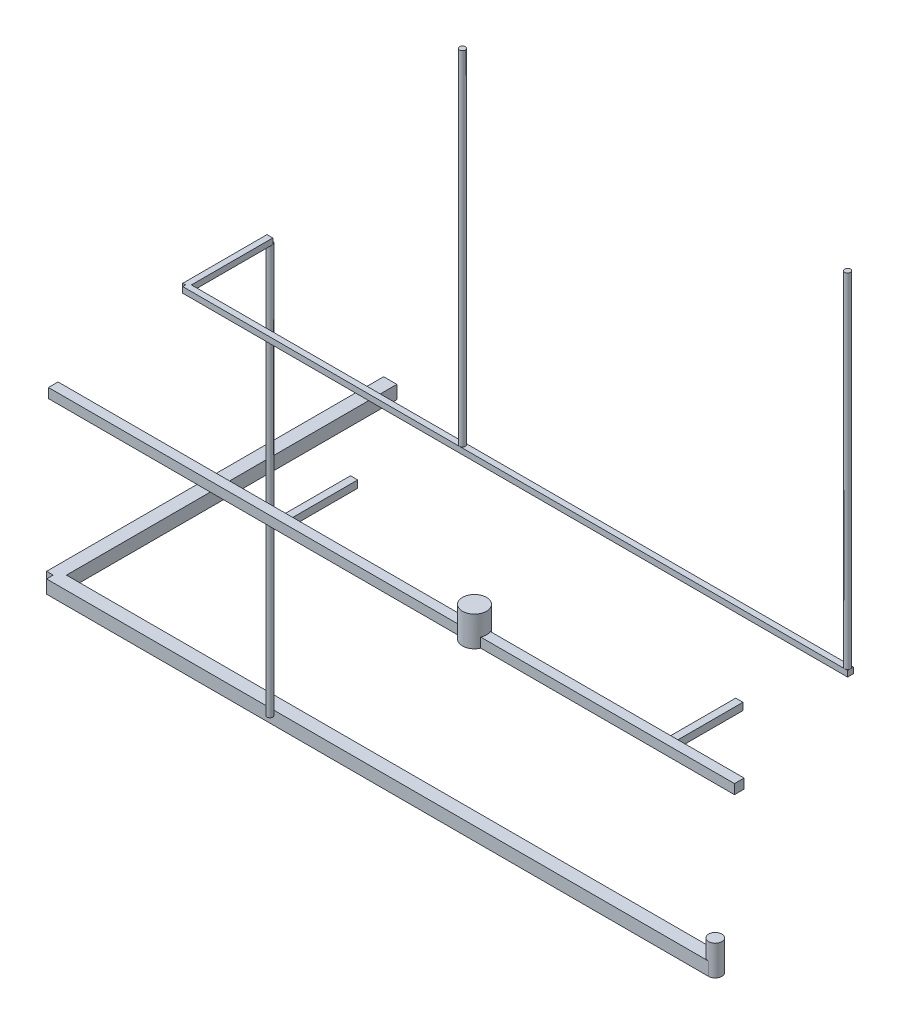
from build123d import *

# Parameters (mm, degrees)
BOSS_EXTRUDE1_START  = 400
SKETCH1_R            = 24
BOSS_EXTRUDE1_DEPTH  = 3400
BOSS_EXTRUDE2_START  = 3800
SKETCH2_W            = 48
SKETCH2_H            = 700
BOSS_EXTRUDE2_DEPTH  = 48
BOSS_EXTRUDE3_START  = 3800
SKETCH3_W            = 5524
SKETCH3_H            = 48
BOSS_EXTRUDE3_DEPTH  = 48
BOSS_EXTRUDE4_START  = 3800
SKETCH4_R            = 24
BOSS_EXTRUDE4_DEPTH  = 2900
BOSS_EXTRUDE5_START  = 3800
SKETCH5_R            = 24
BOSS_EXTRUDE5_DEPTH  = 2900
BOSS_EXTRUDE6_START  = 3600
SKETCH6_W            = 5700
SKETCH6_H            = 80
BOSS_EXTRUDE6_DEPTH  = 80
BOSS_EXTRUDE7_START  = 3600
SKETCH7_R            = 100
BOSS_EXTRUDE7_DEPTH  = 250
BOSS_EXTRUDE8_START  = 3600
SKETCH8_W            = 60
SKETCH8_H            = 600
BOSS_EXTRUDE8_DEPTH  = 60
BOSS_EXTRUDE9_START  = 3600
SKETCH9_W            = 60
SKETCH9_H            = 600
BOSS_EXTRUDE9_DEPTH  = 60
BOSS_EXTRUDE10_START = 200
SKETCH10_R           = 55
BOSS_EXTRUDE10_DEPTH = 250
BOSS_EXTRUDE11_START = 200
SKETCH11_W           = 5500
SKETCH11_H           = 110
BOSS_EXTRUDE11_DEPTH = 110
BOSS_EXTRUDE12_START = 200
SKETCH12_W           = 110
SKETCH12_H           = 2800
BOSS_EXTRUDE12_DEPTH = 110


with BuildPart() as part:
    # Sketch1 → Boss-Extrude1 (new body)
    with BuildSketch(Plane(origin=(0, 0, 0), x_dir=(1, 0, 0), z_dir=(0, 1, 0)).offset(BOSS_EXTRUDE1_START)):
        with Locations((-3500, 1000)):
            Circle(SKETCH1_R)
    extrude(amount=BOSS_EXTRUDE1_DEPTH)

    # Sketch2 → Boss-Extrude2 (add)
    with BuildSketch(Plane(origin=(0, 0, 0), x_dir=(1, 0, 0), z_dir=(0, 1, 0)).offset(BOSS_EXTRUDE2_START)):
        with Locations((-3500, 650)):
            Rectangle(SKETCH2_W, SKETCH2_H)
    extrude(amount=BOSS_EXTRUDE2_DEPTH)

    # Sketch3 → Boss-Extrude3 (add)
    with BuildSketch(Plane(origin=(0, 0, 0), x_dir=(1, 0, 0), z_dir=(0, 1, 0)).offset(BOSS_EXTRUDE3_START)):
        with Locations((-738, 300)):
            Rectangle(SKETCH3_W, SKETCH3_H)
    extrude(amount=BOSS_EXTRUDE3_DEPTH)

    # Sketch4 → Boss-Extrude4 (add)
    with BuildSketch(Plane(origin=(0, 0, 0), x_dir=(1, 0, 0), z_dir=(0, 1, 0)).offset(BOSS_EXTRUDE4_START)):
        with Locations((-1200, 300)):
            Circle(SKETCH4_R)
    extrude(amount=BOSS_EXTRUDE4_DEPTH)

    # Sketch5 → Boss-Extrude5 (add)
    with BuildSketch(Plane(origin=(0, 0, 0), x_dir=(1, 0, 0), z_dir=(0, 1, 0)).offset(BOSS_EXTRUDE5_START)):
        with Locations((2000, 300)):
            Circle(SKETCH5_R)
    extrude(amount=BOSS_EXTRUDE5_DEPTH)


with BuildPart() as body_2:
    # Sketch6 → Boss-Extrude6 (new body)
    with BuildSketch(Plane(origin=(0, 0, 0), x_dir=(1, 0, 0), z_dir=(0, 1, 0)).offset(BOSS_EXTRUDE6_START)):
        with Locations((-650, -800)):
            Rectangle(SKETCH6_W, SKETCH6_H)
    extrude(amount=BOSS_EXTRUDE6_DEPTH)

    # Sketch7 → Boss-Extrude7 (add)
    with BuildSketch(Plane(origin=(0, 0, 0), x_dir=(1, 0, 0), z_dir=(0, 1, 0)).offset(BOSS_EXTRUDE7_START)):
        with Locations((0, -800)):
            Circle(SKETCH7_R)
    extrude(amount=BOSS_EXTRUDE7_DEPTH)

    # Sketch8 → Boss-Extrude8 (add)
    with BuildSketch(Plane(origin=(0, 0, 0), x_dir=(1, 0, 0), z_dir=(0, 1, 0)).offset(BOSS_EXTRUDE8_START)):
        with Locations((-1600, -500)):
            Rectangle(SKETCH8_W, SKETCH8_H)
    extrude(amount=BOSS_EXTRUDE8_DEPTH)

    # Sketch9 → Boss-Extrude9 (add)
    with BuildSketch(Plane(origin=(0, 0, 0), x_dir=(1, 0, 0), z_dir=(0, 1, 0)).offset(BOSS_EXTRUDE9_START)):
        with Locations((1600, -500)):
            Rectangle(SKETCH9_W, SKETCH9_H)
    extrude(amount=BOSS_EXTRUDE9_DEPTH)


with BuildPart() as body_3:
    # Sketch10 → Boss-Extrude10 (new body)
    with BuildSketch(Plane(origin=(0, 0, 0), x_dir=(1, 0, 0), z_dir=(0, 1, 0)).offset(BOSS_EXTRUDE10_START)):
        with Locations((0, 1200)):
            Circle(SKETCH10_R)
    extrude(amount=BOSS_EXTRUDE10_DEPTH)

    # Sketch11 → Boss-Extrude11 (add)
    with BuildSketch(Plane(origin=(0, 0, 0), x_dir=(1, 0, 0), z_dir=(0, 1, 0)).offset(BOSS_EXTRUDE11_START)):
        with Locations((-2750, 1200)):
            Rectangle(SKETCH11_W, SKETCH11_H)
    extrude(amount=BOSS_EXTRUDE11_DEPTH)

    # Sketch12 → Boss-Extrude12 (add)
    with BuildSketch(Plane(origin=(0, 0, 0), x_dir=(1, 0, 0), z_dir=(0, 1, 0)).offset(BOSS_EXTRUDE12_START)):
        with Locations((-5500, 2600)):
            Rectangle(SKETCH12_W, SKETCH12_H)
    extrude(amount=BOSS_EXTRUDE12_DEPTH)


solid = Compound([part.part, body_2.part, body_3.part])
